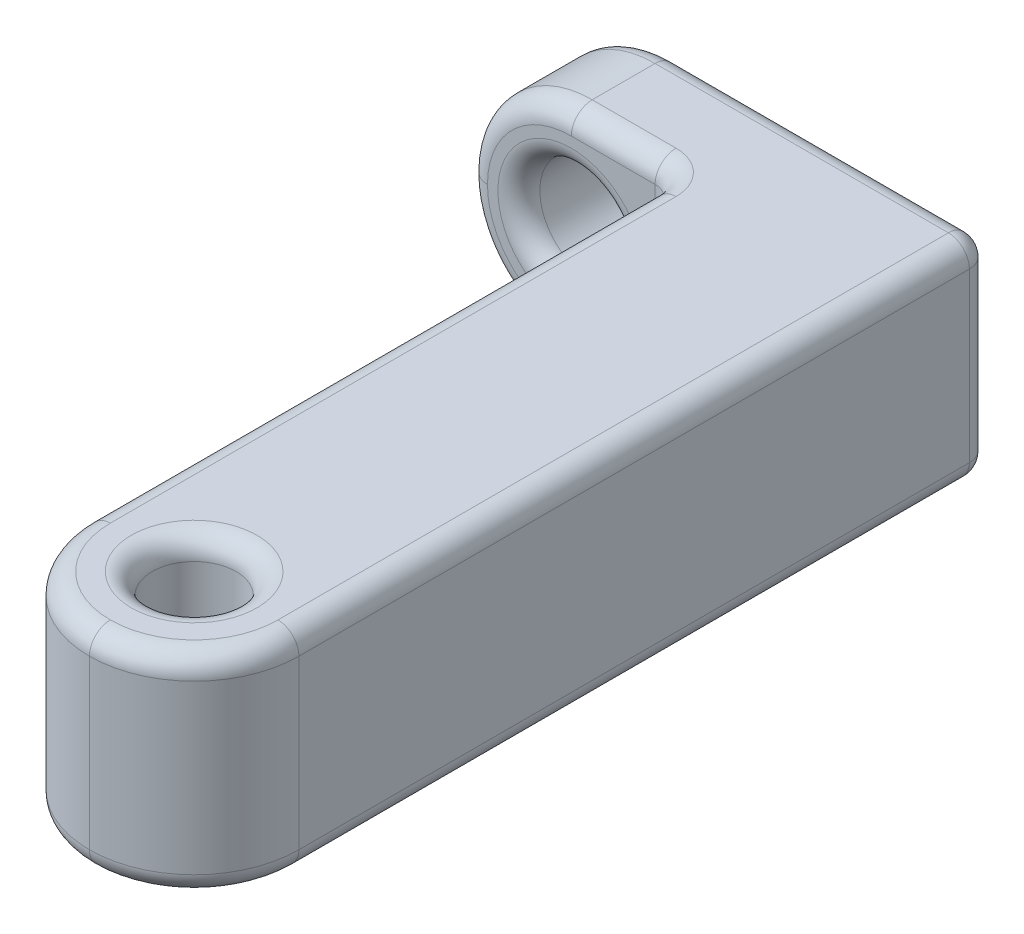
from build123d import *

# Parameters (mm, degrees)
SKETCH1_W           = 10
SKETCH1_H           = 10
SKETCH1_R           = 2.5
BOSS_EXTRUDE1_DEPTH = 5
SKETCH1_4_W         = 10
SKETCH1_4_H         = 10
BOSS_EXTRUDE2_DEPTH = 38
CUT_EXTRUDE1_REACH  = 42.546
SKETCH2_R           = 2
FILLET1_R           = 5
FILLET2_R           = 1


with BuildPart() as part:
    # Sketch1 → Boss-Extrude1 (new body)
    with BuildSketch(Plane.XY):
        with Locations((-5, 0)):
            Rectangle(SKETCH1_W, SKETCH1_H)
        with Locations((-5, 0)):
            Circle(SKETCH1_R, mode=Mode.SUBTRACT)
    extrude(amount=BOSS_EXTRUDE1_DEPTH)

    # Sketch1<4> → Boss-Extrude2 (add)
    with BuildSketch(Plane.XY):
        with Locations((5, 0)):
            Rectangle(SKETCH1_4_W, SKETCH1_4_H)
    extrude(amount=BOSS_EXTRUDE2_DEPTH)

    # Sketch2 → Cut-Extrude1 (cut, up to next)
    with BuildSketch(Plane.XZ.offset(5), mode=Mode.PRIVATE) as cut_extrude1_sk1:
        with Locations(Location((5, 33, 0), (0, 0, 270))):
            Circle(SKETCH2_R)
    cut_extrude1_tool1 = extrude(cut_extrude1_sk1.sketch, amount=-CUT_EXTRUDE1_REACH, mode=Mode.PRIVATE) & part.part
    add(cut_extrude1_tool1.solids().sort_by_distance((5, -5, 33))[0], mode=Mode.SUBTRACT)

    # Fillet1
    fillet1_edges = [part.edges().sort_by_distance(p)[0] for p in [
        (-10, 5, 2.5),
        (-10, -5, 2.5),
        (10, 0, 38),
        (0, 0, 38),
    ]]
    fillet(fillet1_edges, radius=FILLET1_R - 0.0001)  # a hair under: the kernel refuses the full size

    # Fillet2
    fillet2_edges = [part.edges().sort_by_distance(p)[0] for p in [
        (10, 0, 0),
        (0, 0, 5),
        (5, 5, 35),
        (5, -5, 35),
        (2.49995, 5, 0),
        (2.49995, -5, 0),
        (-8.535563195, -3.535563195, 0),
        (-8.535563195, 3.535563195, 0),
        (-2.50005, 5, 5),
        (0, 5, 19.00005),
        (10, 5, 16.50005),
        (1.464436805, 5, 36.535563195),
        (8.535563195, 5, 36.535563195),
        (-2.50005, -5, 5),
        (-8.535563195, -3.535563195, 5),
        (-8.535563195, 3.535563195, 5),
        (10, -5, 16.50005),
        (0, -5, 19.00005),
        (1.464436805, -5, 36.535563195),
        (8.535563195, -5, 36.535563195),
        (-7.5, 0, 5),
        (-7.5, 0, 0),
    ]]
    fillet(fillet2_edges, radius=FILLET2_R)


solid = part.part
